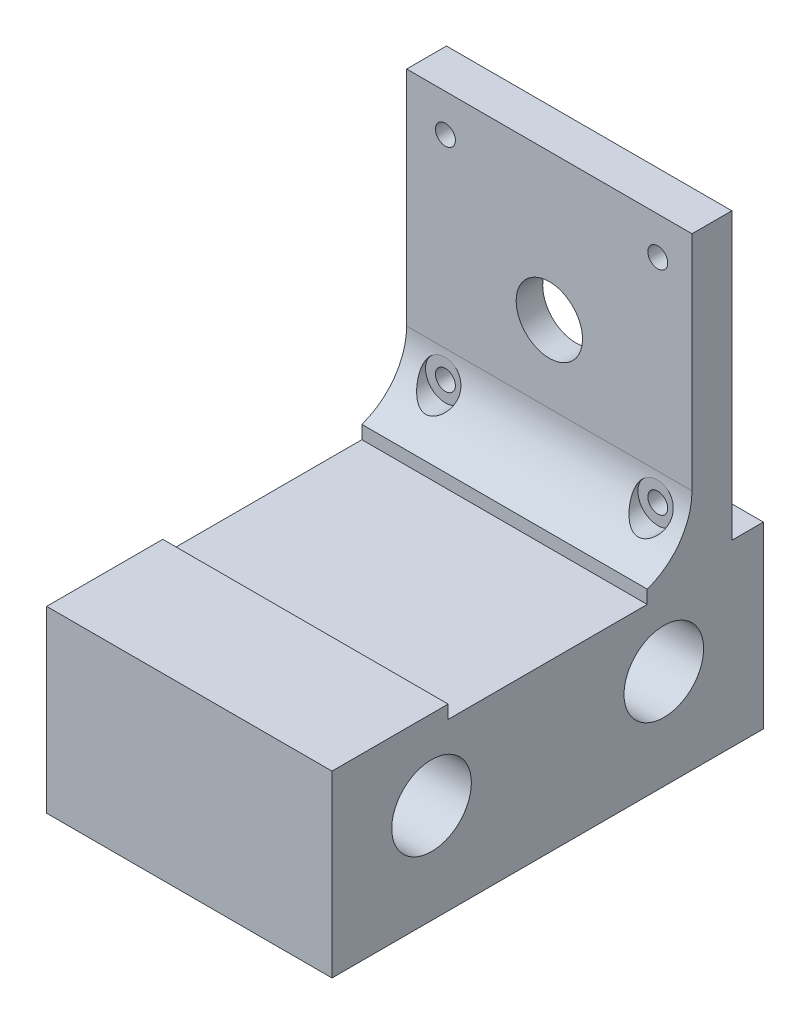
from build123d import *

# Parameters (mm, degrees)
SKETCH9_W                 = 43
SKETCH9_H                 = 27
BOSS_EXTRUDE1_DEPTH       = 32.5
CUT_EXTRUDE1_DEPTH        = 61.284741021
CUT_EXTRUDE1_DEPTH_BACK   = 61.284741021
SKETCH10_R                = 6
CUT_EXTRUDE2_DEPTH        = 3
CUT_EXTRUDE4_DEPTH        = 61.284741021
CUT_EXTRUDE4_DEPTH_BACK   = 61.284741021
SKETCH14_W                = 30
SKETCH14_H                = 2
SKETCH15_W                = 43
SKETCH15_H                = 6
BOSS_EXTRUDE2_DEPTH       = 43
F_3_0MM_DOWEL_HOLE1_D     = 3
F_3_0MM_DOWEL_HOLE1_DEPTH = 6
F_3_0MM_DOWEL_HOLE1_TIP   = 0.901290929
FILLET2_R                 = 10
SKETCH20_R                = 11
CUT_EXTRUDE5_DEPTH        = 2
CUT_EXTRUDE6_DEPTH        = 95.827804467
CUT_EXTRUDE6_DEPTH_BACK   = 95.827804467
SKETCH21_R                = 5
SKETCH21_R_2              = 1.5
SKETCH23_R                = 3
CUT_EXTRUDE7_DEPTH        = 6


with BuildPart() as part:
    # Sketch9 → Boss-Extrude1 (new, symmetric)
    with BuildSketch(Plane.XY):
        with Locations((0, 13.5)):
            Rectangle(SKETCH9_W, SKETCH9_H)
    extrude(amount=BOSS_EXTRUDE1_DEPTH, both=True)

    # Sketch10 → Cut-Extrude1 (cut, two sides: drawn at the far end of the back side and taken through both)
    with BuildSketch(Plane(origin=(21.5, 0, 0), x_dir=(0, 0, -1), z_dir=(1, 0, 0)).offset(-CUT_EXTRUDE1_DEPTH_BACK)):
        with Locations((-17.5, 15)):
            Circle(SKETCH10_R)
        with Locations(Location((17.5, 15, 0), (0, 0, 270))):
            Circle(SKETCH10_R)
    extrude(amount=CUT_EXTRUDE1_DEPTH + CUT_EXTRUDE1_DEPTH_BACK, mode=Mode.SUBTRACT)

    # Sketch11 → Cut-Extrude2 (cut)
    with BuildSketch(Plane.XZ):
        Polygon((12, -12), (13.5, -9.401923789), (16.5, -9.401923789), (18, -12), (16.5, -14.598076211), (13.5, -14.598076211), align=None)
        Polygon((13.5, 9.401923789), (16.5, 9.401923789), (18, 12), (16.5, 14.598076211), (13.5, 14.598076211), (12, 12), align=None)
        Polygon((-13.5, -9.401923789), (-16.5, -9.401923789), (-18, -12), (-16.5, -14.598076211), (-13.5, -14.598076211), (-12, -12), align=None)
        Polygon((-12, 12), (-13.5, 9.401923789), (-16.5, 9.401923789), (-18, 12), (-16.5, 14.598076211), (-13.5, 14.598076211), align=None)
    extrude(amount=-CUT_EXTRUDE2_DEPTH, mode=Mode.SUBTRACT)

    # Sketch14 → Cut-Extrude4 (cut, two sides: drawn at the far end of the back side and taken through both)
    with BuildSketch(Plane(origin=(21.5, 0, 0), x_dir=(0, 0, -1), z_dir=(1, 0, 0)).offset(-CUT_EXTRUDE4_DEPTH_BACK)):
        with Locations((0, 26)):
            Rectangle(SKETCH14_W, SKETCH14_H)
    extrude(amount=CUT_EXTRUDE4_DEPTH + CUT_EXTRUDE4_DEPTH_BACK, mode=Mode.SUBTRACT)

    # Sketch15 → Boss-Extrude2 (add)
    with BuildSketch(Plane(origin=(0, 27, 0), x_dir=(1, 0, 0), z_dir=(0, 1, 0))):
        with Locations((0, 24.75)):
            Rectangle(SKETCH15_W, SKETCH15_H)
    extrude(amount=BOSS_EXTRUDE2_DEPTH)

    # Ø3.0mm Dowel Hole1
    with Locations(Plane(origin=(15, 0, 12), x_dir=(0, 0, -1), z_dir=(0, -1, 0))):
        with Locations((0, 0), (0, -30), (24, -30), (24, 0)):
            Hole(F_3_0MM_DOWEL_HOLE1_D / 2, depth=F_3_0MM_DOWEL_HOLE1_DEPTH)
            with Locations((0, 0, -(F_3_0MM_DOWEL_HOLE1_DEPTH + F_3_0MM_DOWEL_HOLE1_TIP / 2))):  # 118° drill point
                Cone(0, F_3_0MM_DOWEL_HOLE1_D / 2, F_3_0MM_DOWEL_HOLE1_TIP, mode=Mode.SUBTRACT)

    # Fillet2
    # the kernel refuses this fillet: 10 mm, written as the material it adds along each edge
    with BuildSketch(Plane(origin=(21.5, 27, -21.75), x_dir=(0, 0, 1), z_dir=(-1, 0, 0))) as fillet2_piece_1:
        with BuildLine():
            CenterArc((10, 9.45714016), FILLET2_R, 180, 71.034425011)
            Line((0, 9.45714016), (-0.2, 9.45714016))
            Line((-0.2, 9.45714016), (-0.2, 0))
            Line((-0.2, 0), (0, -0.2))
            ThreePointArc((0, -0.2), (3.375, -0.2), (6.685, -0.189142803))
            Line((6.685, -0.189142803), (6.75, 0))
        make_face()
    extrude(amount=43)

    # Sketch20 → Cut-Extrude5 (cut)
    with BuildSketch(Plane(origin=(0, 0, -27.75), x_dir=(-1, 0, 0), z_dir=(0, 0, -1))):
        with Locations((0, 48)):
            Circle(SKETCH20_R)
    extrude(amount=-CUT_EXTRUDE5_DEPTH, mode=Mode.SUBTRACT)

    # Sketch21 → Cut-Extrude6 (cut, two sides: drawn at the far end of the back side and taken through both)
    with BuildSketch(Plane(origin=(0, 0, -27.75), x_dir=(-1, 0, 0), z_dir=(0, 0, -1)).offset(-CUT_EXTRUDE6_DEPTH_BACK)):
        with Locations((0, 48)):
            Circle(SKETCH21_R)
        with Locations((-16.341750707, 64.341750707)):
            Circle(SKETCH21_R_2)
        with Locations((15.658249293, 64.341750707)):
            Circle(SKETCH21_R_2)
        with Locations((15.658249293, 32.341750707)):
            Circle(SKETCH21_R_2)
        with Locations((-16.341750707, 32.341750707)):
            Circle(SKETCH21_R_2)
    extrude(amount=CUT_EXTRUDE6_DEPTH + CUT_EXTRUDE6_DEPTH_BACK, mode=Mode.SUBTRACT)

    # Sketch23 → Cut-Extrude7 (cut)
    with BuildSketch(Plane.XY.offset(-21.75)):
        with Locations(Location((-15.658249293, 32.341750707, 0), (0, 0, 180))):
            Circle(SKETCH23_R)
        with Locations(Location((16.341750707, 32.341750707, 0), (0, 0, 180))):
            Circle(SKETCH23_R)
    extrude(amount=CUT_EXTRUDE7_DEPTH, mode=Mode.SUBTRACT)


solid = part.part
